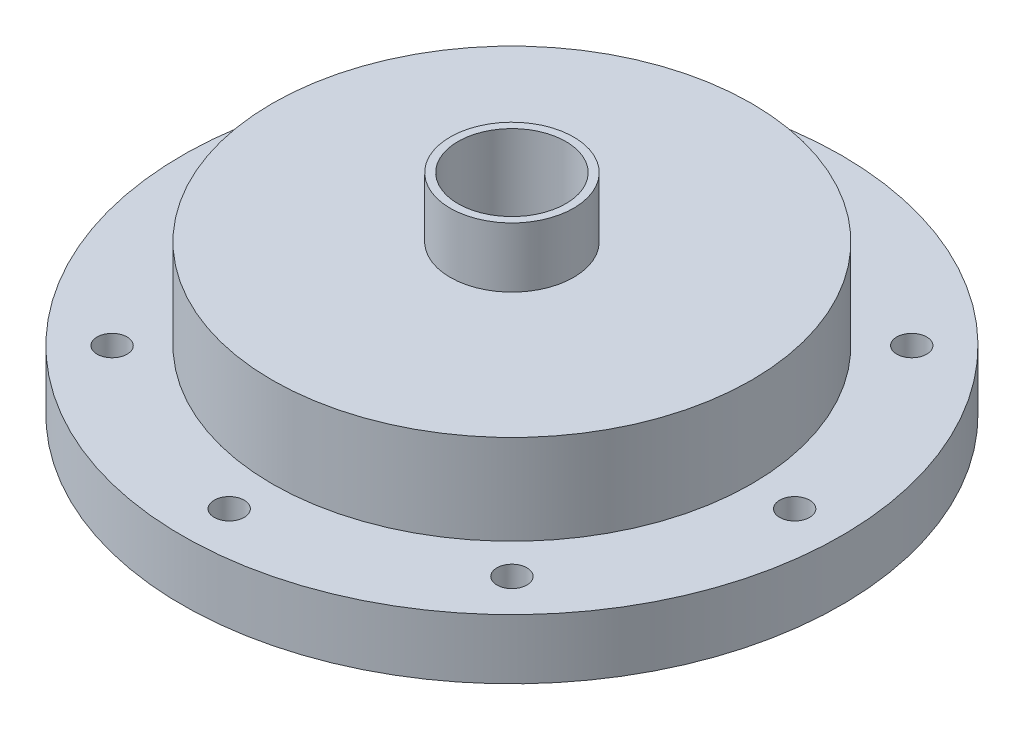
from build123d import *

# Parameters (mm, degrees)
SKETCH1_R           = 50.8
BOSS_EXTRUDE1_DEPTH = 31.75
SKETCH2_R           = 69.85
SKETCH2_R_2         = 50.8
BOSS_EXTRUDE2_DEPTH = 12.7
SKETCH3_R           = 49.53
SKETCH3_R_2         = 47.625
CUT_EXTRUDE1_DEPTH  = 1.1176
CUT_EXTRUDE2_REACH  = 105.76
SKETCH4_R           = 3.175
SKETCH5_R           = 11.43
CUT_EXTRUDE3_DEPTH  = 19.05
CUT_EXTRUDE4_REACH  = 102.603
SKETCH6_R           = 1.5875
CUT_SWEEP8_START    = 1.403690694
CUT_SWEEP8_DEPTH    = 13.66449263
CUT_SWEEP8_START_2  = 0.275893974
CUT_SWEEP8_2_DEPTH  = 13.077597295
CIRPATTERN2_COUNT   = 6
BOSS_EXTRUDE3_START = 12.7
SKETCH34_R          = 13.081
SKETCH34_R_2        = 11.43
BOSS_EXTRUDE3_DEPTH = 12.7


# Read off the part's stored shape, not the designer's step: Cut-Sweep8
with BuildPart() as part:
    # Sketch1 → Boss-Extrude1 (new body)
    with BuildSketch(Plane(origin=(0, 0, 0), x_dir=(1, 0, 0), z_dir=(0, 1, 0))):
        with Locations(Location((0, 0, 0), (0, 0, 270))):
            Circle(SKETCH1_R)
    extrude(amount=BOSS_EXTRUDE1_DEPTH)

    # Sketch2 → Boss-Extrude2 (add)
    with BuildSketch(Plane.XZ):
        with Locations(Location((0, 0, 0), (0, 0, 270))):
            Circle(SKETCH2_R)
        with Locations(Location((0, 0, 0), (0, 0, 270))):
            Circle(SKETCH2_R_2, mode=Mode.SUBTRACT)
    extrude(amount=-BOSS_EXTRUDE2_DEPTH)

    # Sketch3 → Cut-Extrude1 (cut)
    with BuildSketch(Plane.XZ):
        with Locations(Location((0, 0, 0), (0, 0, 270))):
            Circle(SKETCH3_R)
        with Locations(Location((0, 0, 0), (0, 0, 270))):
            Circle(SKETCH3_R_2, mode=Mode.SUBTRACT)
    extrude(amount=-CUT_EXTRUDE1_DEPTH, mode=Mode.SUBTRACT)

    # Sketch4 → Cut-Extrude2 (cut, up to next)
    with BuildSketch(Plane.XZ, mode=Mode.PRIVATE) as cut_extrude2_sk1:
        with Locations(Location((0, -59.9186, 0), (0, 0, 270))):
            Circle(SKETCH4_R)
    cut_extrude2_tool1 = extrude(cut_extrude2_sk1.sketch, amount=-CUT_EXTRUDE2_REACH, mode=Mode.PRIVATE) & part.part
    # Sketch4 → Cut-Extrude2 (cut, up to next)
    with BuildSketch(Plane.XZ, mode=Mode.PRIVATE) as cut_extrude2_sk2:
        with Locations(Location((-42.368848379, -42.368848379, 0), (0, 0, 270))):
            Circle(SKETCH4_R)
    cut_extrude2_tool2 = extrude(cut_extrude2_sk2.sketch, amount=-CUT_EXTRUDE2_REACH, mode=Mode.PRIVATE) & part.part
    # Sketch4 → Cut-Extrude2 (cut, up to next)
    with BuildSketch(Plane.XZ, mode=Mode.PRIVATE) as cut_extrude2_sk3:
        with Locations(Location((-59.9186, 0, 0), (0, 0, 270))):
            Circle(SKETCH4_R)
    cut_extrude2_tool3 = extrude(cut_extrude2_sk3.sketch, amount=-CUT_EXTRUDE2_REACH, mode=Mode.PRIVATE) & part.part
    # Sketch4 → Cut-Extrude2 (cut, up to next)
    with BuildSketch(Plane.XZ, mode=Mode.PRIVATE) as cut_extrude2_sk4:
        with Locations(Location((-42.368848379, 42.368848379, 0), (0, 0, 270))):
            Circle(SKETCH4_R)
    cut_extrude2_tool4 = extrude(cut_extrude2_sk4.sketch, amount=-CUT_EXTRUDE2_REACH, mode=Mode.PRIVATE) & part.part
    # Sketch4 → Cut-Extrude2 (cut, up to next)
    with BuildSketch(Plane.XZ, mode=Mode.PRIVATE) as cut_extrude2_sk5:
        with Locations(Location((0, 59.9186, 0), (0, 0, 270))):
            Circle(SKETCH4_R)
    cut_extrude2_tool5 = extrude(cut_extrude2_sk5.sketch, amount=-CUT_EXTRUDE2_REACH, mode=Mode.PRIVATE) & part.part
    # Sketch4 → Cut-Extrude2 (cut, up to next)
    with BuildSketch(Plane.XZ, mode=Mode.PRIVATE) as cut_extrude2_sk6:
        with Locations(Location((42.368848379, 42.368848379, 0), (0, 0, 270))):
            Circle(SKETCH4_R)
    cut_extrude2_tool6 = extrude(cut_extrude2_sk6.sketch, amount=-CUT_EXTRUDE2_REACH, mode=Mode.PRIVATE) & part.part
    # Sketch4 → Cut-Extrude2 (cut, up to next)
    with BuildSketch(Plane.XZ, mode=Mode.PRIVATE) as cut_extrude2_sk7:
        with Locations(Location((59.9186, 0, 0), (0, 0, 270))):
            Circle(SKETCH4_R)
    cut_extrude2_tool7 = extrude(cut_extrude2_sk7.sketch, amount=-CUT_EXTRUDE2_REACH, mode=Mode.PRIVATE) & part.part
    # Sketch4 → Cut-Extrude2 (cut, up to next)
    with BuildSketch(Plane.XZ, mode=Mode.PRIVATE) as cut_extrude2_sk8:
        with Locations(Location((42.368848379, -42.368848379, 0), (0, 0, 270))):
            Circle(SKETCH4_R)
    cut_extrude2_tool8 = extrude(cut_extrude2_sk8.sketch, amount=-CUT_EXTRUDE2_REACH, mode=Mode.PRIVATE) & part.part
    add(cut_extrude2_tool1.solids().sort_by_distance((0, 0, -59.9186))[0], mode=Mode.SUBTRACT)
    add(cut_extrude2_tool2.solids().sort_by_distance((-42.368848, 0, -42.368848))[0], mode=Mode.SUBTRACT)
    add(cut_extrude2_tool3.solids().sort_by_distance((-59.9186, 0, 0))[0], mode=Mode.SUBTRACT)
    add(cut_extrude2_tool4.solids().sort_by_distance((-42.368848, 0, 42.368848))[0], mode=Mode.SUBTRACT)
    add(cut_extrude2_tool5.solids().sort_by_distance((0, 0, 59.9186))[0], mode=Mode.SUBTRACT)
    add(cut_extrude2_tool6.solids().sort_by_distance((42.368848, 0, 42.368848))[0], mode=Mode.SUBTRACT)
    add(cut_extrude2_tool7.solids().sort_by_distance((59.9186, 0, 0))[0], mode=Mode.SUBTRACT)
    add(cut_extrude2_tool8.solids().sort_by_distance((42.368848, 0, -42.368848))[0], mode=Mode.SUBTRACT)

    # Sketch5 → Cut-Extrude3 (cut)
    with BuildSketch(Plane(origin=(0, 31.75, 0), x_dir=(1, 0, 0), z_dir=(0, 1, 0))):
        with Locations(Location((0, 0, 0), (0, 0, 270))):
            Circle(SKETCH5_R)
    extrude(amount=-CUT_EXTRUDE3_DEPTH, mode=Mode.SUBTRACT)

    # Sketch6 → Cut-Extrude4 (cut, up to next)
    with BuildSketch(Plane(origin=(0, 12.7, 0), x_dir=(1, 0, 0), z_dir=(0, 1, 0)), mode=Mode.PRIVATE) as cut_extrude4_sk1:
        with Locations(Location((0, 0, 0), (0, 0, 270))):
            Circle(SKETCH6_R)
    cut_extrude4_tool1 = extrude(cut_extrude4_sk1.sketch, amount=-CUT_EXTRUDE4_REACH, mode=Mode.PRIVATE) & part.part
    add(cut_extrude4_tool1.solids().sort_by_distance((0, 12.7, 0))[0], mode=Mode.SUBTRACT)

    # Cut-Sweep8 outline → Cut-Sweep8 (cut)
    with BuildSketch(Plane(origin=(0, 0, 0), x_dir=(1, 0, 0), z_dir=(0, 0.9703120732527684, -0.24185632201766868)).offset(CUT_SWEEP8_START)):
        with BuildLine():
            add(Edge.make_bspline(
                [(0, 5.631517562), (2.38125, 5.631517562), (2.38125, 7.942073187), (0, 7.942073187), (-2.38125, 7.942073187), (-2.38125, 5.631517562), (0, 5.631517562)],
                knots=[0, 0, 0, 0, 0.5, 0.5, 0.5, 1, 1, 1, 1], degree=3, weights=[1, 0.333333333, 0.333333333, 1, 0.333333333, 0.333333333, 1]))
        make_face()
    cut_sweep8 = extrude(amount=CUT_SWEEP8_DEPTH, mode=Mode.SUBTRACT)

    # Cut-Sweep8 2 outline → Cut-Sweep8 2 (cut)
    with BuildSketch(Plane(origin=(0, 0, 0), x_dir=(1, 0, 0), z_dir=(0, 0.9925921043162648, -0.12149450378107311)).offset(CUT_SWEEP8_START_2)):
        with BuildLine():
            add(Edge.make_bspline(
                [(0, 4.564567797), (2.38125, 4.564567797), (2.38125, 2.254012172), (0, 2.254012172), (-2.38125, 2.254012172), (-2.38125, 4.564567797), (0, 4.564567797)],
                knots=[0, 0, 0, 0, 0.5, 0.5, 0.5, 1, 1, 1, 1], degree=3, weights=[1, 0.333333333, 0.333333333, 1, 0.333333333, 0.333333333, 1]))
        make_face()
    cut_sweep8_2 = extrude(amount=CUT_SWEEP8_2_DEPTH, mode=Mode.SUBTRACT)

    # CirPattern2: Cut-Sweep8, Cut-Sweep8 2 ×6 about axis
    cirpattern2_axis = Axis((0, -28.061269261, 0), (0, 1, 0))
    add([cut_sweep8.rotate(cirpattern2_axis, i * 360 / CIRPATTERN2_COUNT) for i in range(1, CIRPATTERN2_COUNT)], mode=Mode.SUBTRACT)
    add([cut_sweep8_2.rotate(cirpattern2_axis, i * 360 / CIRPATTERN2_COUNT) for i in range(1, CIRPATTERN2_COUNT)], mode=Mode.SUBTRACT)

    # Sketch34 → Boss-Extrude3 (add)
    with BuildSketch(Plane(origin=(0, 31.75, 0), x_dir=(1, 0, 0), z_dir=(0, 1, 0)).offset(BOSS_EXTRUDE3_START)):
        with Locations(Location((0, 0, 0), (0, 0, 270))):
            Circle(SKETCH34_R)
        with Locations(Location((0, 0, 0), (0, 0, 270))):
            Circle(SKETCH34_R_2, mode=Mode.SUBTRACT)
    extrude(amount=-BOSS_EXTRUDE3_DEPTH)


solid = part.part
